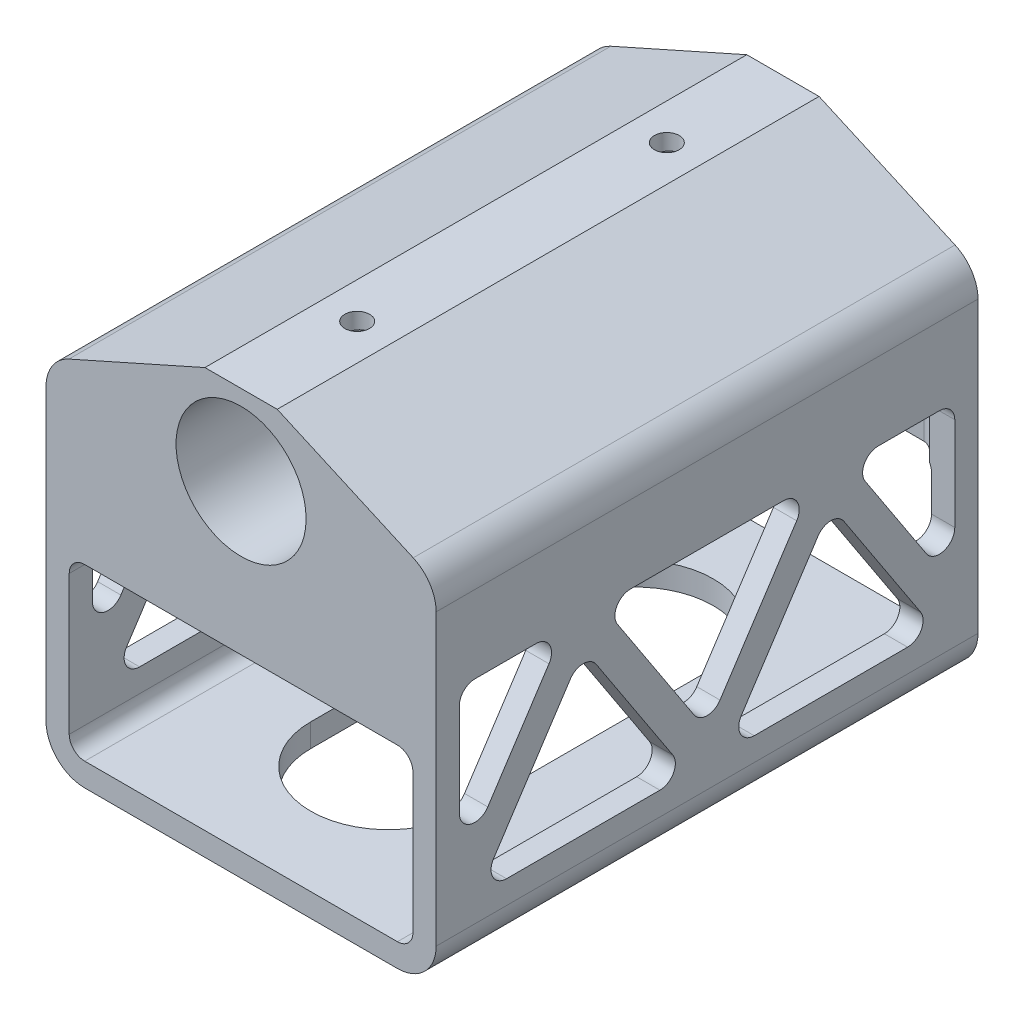
from build123d import *

# Parameters (mm, degrees)
SKETCH_1_R               = 11.4
SKETCH_1_R_2             = 8.4
EXTRUDE_1_DEPTH          = 35
FILLET_1_R               = 10
EXTRUDE_START            = -2
EXTRUDE_2_DEPTH          = 2
FILLET_2_R               = 2
FILLET_2_OF_MIRROR_1_R   = 2
FILLET_3_R               = 2
CUT_EXTRUDE_1_DEPTH      = 76.739817798
CUT_EXTRUDE_1_DEPTH_BACK = 76.739817798
FILLET_4_R               = 2
SKETCH_4_R               = 1.6
CUT_EXTRUDE_2_DEPTH      = 30
SKETCH_4_3_R             = 2.5
SKETCH_4_3_R_2           = 1.6
CUT_EXTRUDE_3_DEPTH      = 1
CUT_EXTRUDE_START        = -21.3
SKETCH_4_4_R             = 2.5
SKETCH_4_4_R_2           = 1.6
CUT_EXTRUDE_4_DEPTH      = 1.5
CUT_EXTRUDE_5_DEPTH      = 4.5
CUT_EXTRUDE_6_DEPTH      = 87.639483026
CUT_EXTRUDE_6_DEPTH_BACK = 87.639483026
SKETCH_6_W               = 10.21496916
SKETCH_6_H               = 1.741001226


# Read off the part's stored shape, not the designer's step: Зеркальное отражение2
with BuildPart() as part:
    # Эскиз1 → Бобышка-Вытянуть1 (new, symmetric)
    # profile 1 of 4: a face of its own
    with BuildSketch(Plane.XY):
        Circle(SKETCH_1_R)
        Circle(SKETCH_1_R_2, mode=Mode.SUBTRACT)
    # profile 2 of 4: a face of its own
    with BuildSketch(Plane.XY):
        with BuildLine():
            Line((-20.2, 3), (-10.998181668, 3))
            ThreePointArc((-10.998181668, 3), (-8.654088609, 7.42069743), (-4.642749152, 10.411766436))
            Line((-4.642749152, 10.411766436), (-22.236293488, 2.566564226))
            ThreePointArc((-22.236293488, 2.566564226), (-21.24095602, 2.890440733), (-20.2, 3))
        make_face()
    # profile 3 of 4: a face of its own
    with BuildSketch(Plane.XY):
        with BuildLine():
            ThreePointArc((4.642749152, 10.411766436), (8.654088609, 7.42069743), (10.998181668, 3))
            Line((10.998181668, 3), (20.2, 3))
            ThreePointArc((20.2, 3), (21.24095602, 2.890440733), (22.236293488, 2.566564226))
            Line((22.236293488, 2.566564226), (4.642749152, 10.411766436))
        make_face()
    # profile 4 of 4: a face of its own
    with BuildSketch(Plane.XY):
        with BuildLine():
            Line((-20.2, 0), (-11.4, 0))
            ThreePointArc((-11.4, 0), (-11.29909888, 1.513395022), (-10.998181668, 3))
            Line((-10.998181668, 3), (-20.2, 3))
            ThreePointArc((-20.2, 3), (-21.24095602, 2.890440733), (-22.236293488, 2.566564226))
            ThreePointArc((-22.236293488, 2.566564226), (-24.394130866, 0.721996745), (-25.2, -2))
            Line((-25.2, -2), (-25.2, -39.4))
            ThreePointArc((-25.2, -39.4), (-23.735533906, -42.935533906), (-20.2, -44.4))
            Line((-20.2, -44.4), (20.2, -44.4))
            ThreePointArc((20.2, -44.4), (23.735533906, -42.935533906), (25.2, -39.4))
            Line((25.2, -39.4), (25.2, -2))
            ThreePointArc((25.2, -2), (24.394130866, 0.721996745), (22.236293488, 2.566564226))
            ThreePointArc((22.236293488, 2.566564226), (21.24095602, 2.890440733), (20.2, 3))
            Line((20.2, 3), (10.998181668, 3))
            ThreePointArc((10.998181668, 3), (11.29909888, 1.513395022), (11.4, 0))
            Line((11.4, 0), (20.2, 0))
            ThreePointArc((20.2, 0), (21.614213562, -0.585786438), (22.2, -2))
            Line((22.2, -2), (22.2, -34.4))
            Line((22.2, -34.4), (22.2, -39.4))
            ThreePointArc((22.2, -39.4), (21.614213562, -40.814213562), (20.2, -41.4))
            Line((20.2, -41.4), (-20.2, -41.4))
            ThreePointArc((-20.2, -41.4), (-21.614213562, -40.814213562), (-22.2, -39.4))
            Line((-22.2, -39.4), (-22.2, -34.4))
            Line((-22.2, -34.4), (-22.2, -2))
            ThreePointArc((-22.2, -2), (-21.614213562, -0.585786438), (-20.2, 0))
        make_face()
    extrude(amount=EXTRUDE_1_DEPTH, both=True)

    # Скругление1
    fillet_1_edges = [part.edges().sort_by_distance(p)[0] for p in [
        (-11.4, 0, 0),
        (11.4, 0, 0),
    ]]
    fillet(fillet_1_edges, radius=FILLET_1_R)

    # Эскиз2 → Бобышка-Вытянуть2 (add)
    with BuildSketch(Plane(origin=(0, 0, -35), x_dir=(-1, 0, 0), z_dir=(0, 0, -1)).offset(EXTRUDE_START)):
        with BuildLine():
            Line((22.2, -19.4), (22.2, -2))
            ThreePointArc((22.2, -2), (21.614213562, -0.585786438), (20.2, 0))
            Line((20.2, 0), (18.919830866, 0))
            ThreePointArc((18.919830866, 0), (13.758870295, -1.434692885), (10.078788405, -5.327102804))
            ThreePointArc((10.078788405, -5.327102804), (0, -11.4), (-10.078788405, -5.327102804))
            ThreePointArc((-10.078788405, -5.327102804), (-13.758870295, -1.434692885), (-18.919830866, 0))
            Line((-18.919830866, 0), (-20.2, 0))
            ThreePointArc((-20.2, 0), (-21.614213562, -0.585786438), (-22.2, -2))
            Line((-22.2, -2), (-22.2, -19.4))
            Line((-22.2, -19.4), (22.2, -19.4))
        make_face()
    extrude_2 = extrude(amount=EXTRUDE_2_DEPTH)

    # Скругление2
    fillet_2_edges = [part.edges().sort_by_distance(p)[0] for p in [
        (22.2, -19.4, -34),
        (-22.2, -19.4, -34),
    ]]
    fillet(fillet_2_edges, radius=FILLET_2_R)

    # Зеркальное отражение1: Бобышка-Вытянуть2 across plane
    add(extrude_2.mirror(Plane.XY))

    # Скругление2 of Зеркальное отражение1
    fillet_2_of_mirror_1_edges = [part.edges().sort_by_distance(p)[0] for p in [
        (22.2, -19.4, 34),
        (-22.2, -19.4, 34),
    ]]
    fillet(fillet_2_of_mirror_1_edges, radius=FILLET_2_OF_MIRROR_1_R)

    # Скругление3
    fillet_3_edges = [part.edges().sort_by_distance(p)[0] for p in [
        (22.2, -11.7, -33),
        (21.614213562, -0.585786438, -33),
        (19.559915433, 0, -33),
        (13.758870295, -1.434692885, -33),
        (-22.2, -11.7, -33),
        (-21.614213562, -0.585786438, -33),
        (-19.559915433, 0, -33),
        (-13.758870295, -1.434692885, -33),
        (22.2, -11.7, 33),
        (21.614213562, -0.585786438, 33),
        (19.559915433, 0, 33),
        (13.758870295, -1.434692885, 33),
        (-22.2, -11.7, 33),
        (-21.614213562, -0.585786438, 33),
        (-19.559915433, 0, 33),
        (-13.758870295, -1.434692885, 33),
        (0, -11.4, -33),
        (0, -11.4, 33),
    ]]
    fillet(fillet_3_edges, radius=FILLET_3_R)

    # Эскиз3 → Вырез-Вытянуть1 (cut, two sides: drawn at the far end of the back side and taken through both)
    with BuildSketch(Plane.ZY.offset(25.2).offset(-CUT_EXTRUDE_1_DEPTH_BACK)):
        Polygon((-32, -32.752740755), (-18.391645407, -12), (-32, -12), align=None)
        Polygon((-29.608354593, -36.4), (-2.391645407, -36.4), (-16, -15.647259245), align=None)
        Polygon((0, -32.752740755), (13.608354593, -12), (-13.608354593, -12), align=None)
        Polygon((2.391645407, -36.4), (29.608354593, -36.4), (16, -15.647259245), align=None)
        Polygon((32, -32.752740755), (32, -12), (18.391645407, -12), align=None)
    extrude(amount=CUT_EXTRUDE_1_DEPTH + CUT_EXTRUDE_1_DEPTH_BACK, mode=Mode.SUBTRACT)

    # Скругление4
    fillet_4_edges = [part.edges().sort_by_distance(p)[0] for p in [
        (-23.7, -15.647259245, 16),
        (-23.7, -36.4, 2.391645407),
        (-23.7, -12, -13.608354593),
        (-23.7, -32.752740755, 0),
        (-23.7, -36.4, -2.391645407),
        (-23.7, -15.647259245, -16),
        (-23.7, -32.752740755, -32),
        (-23.7, -36.4, -29.608354593),
        (-23.7, -36.4, 29.608354593),
        (-23.7, -32.752740755, 32),
        (-23.566025404, -12, 32),
        (-23.7, -12, 13.608354593),
        (-23.7, -12, -18.391645407),
        (-23.566025404, -12, -32),
        (-23.7, -12, 18.391645407),
    ]]
    fillet(fillet_4_edges, radius=FILLET_4_R)

    # Зеркальное отражение2: part across plane


with BuildPart() as part_1:
    add(part.part)
    add(part.part.mirror(Plane(origin=(0, 0, 0), x_dir=(0, 0, 1), z_dir=(1, 0, 0))))

    # Эскиз4 → Вырез-Вытянуть2 (cut)
    with BuildSketch(Plane(origin=(0, 11.4, 0), x_dir=(1, 0, 0), z_dir=(0, 1, 0))):
        with Locations(Location((0, 20, 0), (0, 0, 270))):
            Circle(SKETCH_4_R)
        with Locations(Location((0, -20, 0), (0, 0, 270))):
            Circle(SKETCH_4_R)
    extrude(amount=-CUT_EXTRUDE_2_DEPTH, mode=Mode.SUBTRACT)

    # Эскиз4<3> → Вырез-Вытянуть3 (cut)
    # profile 1 of 2: a face of its own
    with BuildSketch(Plane(origin=(0, 11.4, 0), x_dir=(1, 0, 0), z_dir=(0, 1, 0))):
        with Locations(Location((0, 20, 0), (0, 0, 270))):
            Circle(SKETCH_4_3_R)
        with Locations(Location((0, 20, 0), (0, 0, 270))):
            Circle(SKETCH_4_3_R_2, mode=Mode.SUBTRACT)
    # profile 2 of 2: a face of its own
    with BuildSketch(Plane(origin=(0, 11.4, 0), x_dir=(1, 0, 0), z_dir=(0, 1, 0))):
        with Locations(Location((0, -20, 0), (0, 0, 270))):
            Circle(SKETCH_4_3_R)
        with Locations(Location((0, -20, 0), (0, 0, 270))):
            Circle(SKETCH_4_3_R_2, mode=Mode.SUBTRACT)
    extrude(amount=-CUT_EXTRUDE_3_DEPTH, mode=Mode.SUBTRACT)

    # Эскиз4<4> → Вырез-Вытянуть4 (cut)
    # profile 1 of 4: a face of its own
    with BuildSketch(Plane(origin=(0, 11.4, 0), x_dir=(1, 0, 0), z_dir=(0, 1, 0)).offset(CUT_EXTRUDE_START)):
        Polygon((0, -23.175426481), (2.75, -21.58771324), (2.75, -18.41228676), (0, -16.824573519), (-2.75, -18.41228676), (-2.75, -21.58771324), align=None)
        with Locations(Location((0, -20, 0), (0, 0, 270))):
            Circle(SKETCH_4_4_R, mode=Mode.SUBTRACT)
    # profile 2 of 4: a face of its own
    with BuildSketch(Plane(origin=(0, 11.4, 0), x_dir=(1, 0, 0), z_dir=(0, 1, 0)).offset(CUT_EXTRUDE_START)):
        with Locations(Location((0, -20, 0), (0, 0, 270))):
            Circle(SKETCH_4_4_R)
        with Locations(Location((0, -20, 0), (0, 0, 270))):
            Circle(SKETCH_4_4_R_2, mode=Mode.SUBTRACT)
    # profile 3 of 4: a face of its own
    with BuildSketch(Plane(origin=(0, 11.4, 0), x_dir=(1, 0, 0), z_dir=(0, 1, 0)).offset(CUT_EXTRUDE_START)):
        Polygon((2.75, 18.41228676), (0, 16.824573519), (-2.75, 18.41228676), (-2.75, 21.58771324), (0, 23.175426481), (2.75, 21.58771324), align=None)
        with Locations(Location((0, 20, 0), (0, 0, 270))):
            Circle(SKETCH_4_4_R, mode=Mode.SUBTRACT)
    # profile 4 of 4: a face of its own
    with BuildSketch(Plane(origin=(0, 11.4, 0), x_dir=(1, 0, 0), z_dir=(0, 1, 0)).offset(CUT_EXTRUDE_START)):
        with Locations(Location((0, 20, 0), (0, 0, 270))):
            Circle(SKETCH_4_4_R)
        with Locations(Location((0, 20, 0), (0, 0, 270))):
            Circle(SKETCH_4_4_R_2, mode=Mode.SUBTRACT)
    extrude(amount=-CUT_EXTRUDE_4_DEPTH, mode=Mode.SUBTRACT)

    # Эскиз5 → Вырез-Вытянуть5 (cut)
    with BuildSketch(Plane.XZ.offset(44.4)):
        with BuildLine():
            Line((-10, -16), (-10, 16))
            ThreePointArc((-10, 16), (0, 26), (10, 16))
            Line((10, 16), (10, -16))
            ThreePointArc((10, -16), (0, -26), (-10, -16))
        make_face()
    extrude(amount=-CUT_EXTRUDE_5_DEPTH, mode=Mode.SUBTRACT)

    # Эскиз6 → Вырез-Вытянуть6 (cut, two sides: drawn at the far end of the back side and taken through both)
    with BuildSketch(Plane.XY.offset(35).offset(-CUT_EXTRUDE_6_DEPTH_BACK)):
        with Locations((0.211066946, 11.270500613)):
            Rectangle(SKETCH_6_W, SKETCH_6_H)
    extrude(amount=CUT_EXTRUDE_6_DEPTH + CUT_EXTRUDE_6_DEPTH_BACK, mode=Mode.SUBTRACT)


solid = part_1.part
